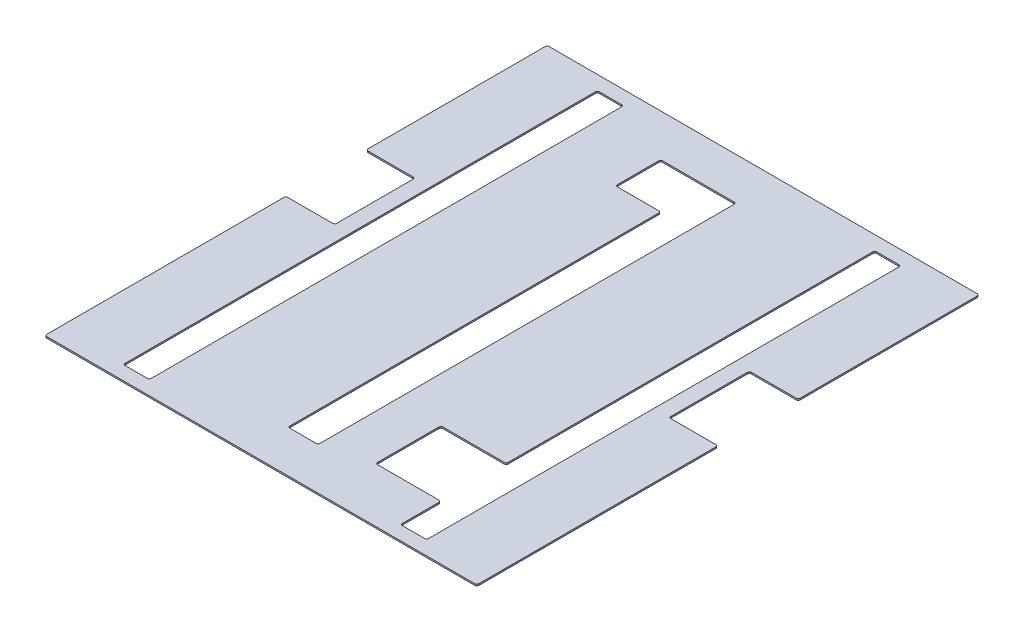
from build123d import *

# Parameters (mm, degrees)
SKETCH1_W           = 430
SKETCH1_H           = 500
BOSS_EXTRUDE1_DEPTH = 1.5
SKETCH2_W           = 48.6
SKETCH2_H           = 80
CUT_EXTRUDE1_DEPTH  = 10
SKETCH3_W           = 26
SKETCH3_H           = 472
CUT_EXTRUDE2_DEPTH  = 10
SKETCH4_W           = 65
SKETCH4_H           = 65
CUT_EXTRUDE3_DEPTH  = 10
FILLET2_R           = 2
FILLET3_R           = 2


with BuildPart() as part:
    # Sketch1 → Boss-Extrude1 (new body)
    with BuildSketch(Plane(origin=(0, 0, 0), x_dir=(1, 0, 0), z_dir=(0, 1, 0))):
        with Locations((6126.084066999, -8702.312377786)):
            Rectangle(SKETCH1_W, SKETCH1_H)
    extrude(amount=BOSS_EXTRUDE1_DEPTH)

    # Sketch2 → Cut-Extrude1 (cut)
    with BuildSketch(Plane(origin=(0, 1.5, 0), x_dir=(1, 0, 0), z_dir=(0, 1, 0))):
        with Locations((5935.384066999, -8672.447976714)):
            Rectangle(SKETCH2_W, SKETCH2_H)
        with Locations((6316.784066999, -8672.447976714)):
            Rectangle(SKETCH2_W, SKETCH2_H)
    extrude(amount=-CUT_EXTRUDE1_DEPTH, mode=Mode.SUBTRACT)

    # Sketch3 → Cut-Extrude2 (cut)
    with BuildSketch(Plane(origin=(0, 1.5, 0), x_dir=(1, 0, 0), z_dir=(0, 1, 0))):
        Polygon((5975.084066999, -8541.651929061), (5975.084066999, -8938.312377786), (6001.084066999, -8938.312377786), (6001.084066999, -8466.312377786), (5975.084066999, -8466.312377786), align=None)
        with Locations((6264.084066999, -8702.312377786)):
            Rectangle(SKETCH3_W, SKETCH3_H)
        Polygon((6111.084066999, -8494.312377786), (6141.084066999, -8494.312377786), (6141.084066999, -8910.312377786), (6111.084066999, -8910.312377786), (6111.084066999, -8539.312377786), (6066.084066999, -8539.312377786), (6066.084066999, -8494.312377786), align=None)
    extrude(amount=-CUT_EXTRUDE2_DEPTH, mode=Mode.SUBTRACT)

    # Sketch4 → Cut-Extrude3 (cut)
    with BuildSketch(Plane(origin=(0, 1.5, 0), x_dir=(1, 0, 0), z_dir=(0, 1, 0))):
        with Locations((6218.584066999, -8865.596518708)):
            Rectangle(SKETCH4_W, SKETCH4_H)
    extrude(amount=-CUT_EXTRUDE3_DEPTH, mode=Mode.SUBTRACT)

    # Fillet2
    fillet2_edges = [part.edges().sort_by_distance(p)[0] for p in [
        (6292.484066999, 0.75, 8632.447976714),
        (6341.084066999, 0.75, 8632.447976714),
        (6341.084066999, 0.75, 8712.447976714),
        (6292.484066999, 0.75, 8712.447976714),
        (5959.684066999, 0.75, 8632.447976714),
        (5959.684066999, 0.75, 8712.447976714),
        (5911.084066999, 0.75, 8712.447976714),
        (5911.084066999, 0.75, 8632.447976714),
        (5911.084066999, 0.75, 8452.312377786),
        (6341.084066999, 0.75, 8452.312377786),
        (6341.084066999, 0.75, 8952.312377786),
        (5911.084066999, 0.75, 8952.312377786),
    ]]
    fillet(fillet2_edges, radius=FILLET2_R)

    # Fillet3
    fillet3_edges = [part.edges().sort_by_distance(p)[0] for p in [
        (6001.084066999, 0.75, 8938.312377786),
        (5975.084066999, 0.75, 8938.312377786),
        (6001.084066999, 0.75, 8466.312377786),
        (5975.084066999, 0.75, 8466.312377786),
        (6277.084066999, 0.75, 8938.312377786),
        (6251.084066999, 0.75, 8938.312377786),
        (6277.084066999, 0.75, 8466.312377786),
        (6251.084066999, 0.75, 8466.312377786),
        (6141.084066999, 0.75, 8910.312377786),
        (6111.084066999, 0.75, 8910.312377786),
        (6141.084066999, 0.75, 8494.312377786),
        (6111.084066999, 0.75, 8539.312377786),
        (6066.084066999, 0.75, 8494.312377786),
        (6066.084066999, 0.75, 8539.312377786),
        (6251.084066999, 0.75, 8898.096518708),
        (6251.084066999, 0.75, 8833.096518708),
        (6186.084066999, 0.75, 8833.096518708),
        (6186.084066999, 0.75, 8898.096518708),
    ]]
    fillet(fillet3_edges, radius=FILLET3_R)


solid = part.part
